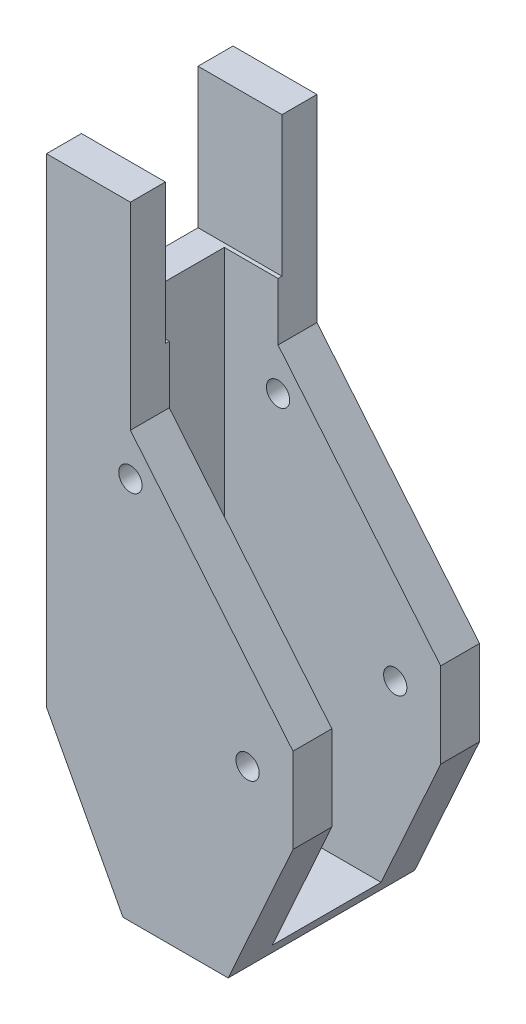
from build123d import *

# Parameters (mm, degrees)
SKETCH_1_W          = 41.838517058
SKETCH_1_H          = 61.659283987
SKETCH_1_R          = 1.5
EXTRUDE_1_DEPTH     = 24
SHELL_START         = 5
SHELL_2_OUTLINE_R   = 6.5
SHELL_2_DEPTH       = 14
SKETCH_7_W          = 14
SKETCH_7_H          = 61.659283987
CUT_EXTRUDE_2_DEPTH = 38
SKETCH_11_W         = 14
SKETCH_11_H         = 61.659283987
EXTRUDE_2_DEPTH     = 14
SKETCH_12_W         = 10.1213772
SKETCH_12_H         = 61.659283987
CUT_EXTRUDE_3_DEPTH = 52.896145639
CUT_EXTRUDE_5_DEPTH = 47.819908548
SKETCH_18_W         = 15
SKETCH_18_H         = 18
CUT_EXTRUDE_6_DEPTH = 54.011520411
EXTRUDE_5_DEPTH     = 24
SKETCH_22_W         = 27.838517058
SKETCH_22_H         = 14
CUT_EXTRUDE_8_DEPTH = 17
SKETCH_23_W         = 14.991158549
SKETCH_23_H         = 11.73336261
EXTRUDE_8_DEPTH     = 2
FILLET_3_R          = 4


# Read off the part's stored shape, not the designer's step: 抽壳2
with BuildPart() as part:
    # 草图1 → 凸台-拉伸1 (new body)
    with BuildSketch(Plane.XY):
        with Locations((-8.896267572, -4.216675009)):
            Rectangle(SKETCH_1_W, SKETCH_1_H)
        with Locations((-8.896267572, -4.21667501)):
            Circle(SKETCH_1_R, mode=Mode.SUBTRACT)
        with Locations((6.176232993, -28.71667501)):
            Circle(SKETCH_1_R, mode=Mode.SUBTRACT)
    extrude(amount=EXTRUDE_1_DEPTH)

    # 抽壳2 outline → 抽壳2 (cut)
    # profile 1 of 2: a face of its own
    with BuildSketch(Plane.XY.offset(SHELL_START)):
        with BuildLine():
            Line((-24.815526101, 26.612966984), (-24.815526101, -35.046317003))
            Line((-24.815526101, -35.046317003), (4.697844602, -35.046317003))
            ThreePointArc((4.697844602, -35.046317003), (1.097738874, -24.659718332), (12.022990957, -25.876706469))
            Line((12.022990957, -25.876706469), (12.022990957, 26.612966984))
            Line((12.022990957, 26.612966984), (-24.815526101, 26.612966984))
        make_face()
        with Locations((-8.896267572, -4.21667501)):
            Circle(SHELL_2_OUTLINE_R, mode=Mode.SUBTRACT)
    # profile 2 of 2: a face of its own
    with BuildSketch(Plane.XY.offset(SHELL_START)):
        with BuildLine():
            ThreePointArc((12.022990957, -31.556643551), (10.23318967, -33.795169129), (7.654621384, -35.046317003))
            Line((7.654621384, -35.046317003), (12.022990957, -35.046317003))
            Line((12.022990957, -35.046317003), (12.022990957, -31.556643551))
        make_face()
    extrude(amount=SHELL_2_DEPTH, mode=Mode.SUBTRACT)

    # 草图7 → 切除-拉伸2 (cut)
    with BuildSketch(Plane(origin=(12.022990957, 0, 0), x_dir=(0, 0, -1), z_dir=(1, 0, 0))):
        with Locations((-12, -4.216675009)):
            Rectangle(SKETCH_7_W, SKETCH_7_H)
    extrude(amount=-CUT_EXTRUDE_2_DEPTH, mode=Mode.SUBTRACT)

    # 草图11 → 凸台-拉伸2 (add)
    with BuildSketch(Plane.ZY.offset(29.815526101)):
        with Locations((12, -4.216675009)):
            Rectangle(SKETCH_11_W, SKETCH_11_H)
    extrude(amount=-EXTRUDE_2_DEPTH)

    # 草图12 → 切除-拉伸3 (cut, through all)
    with BuildSketch(Plane.XY.offset(24)):
        with Locations((-24.754837501, -4.216675009)):
            Rectangle(SKETCH_12_W, SKETCH_12_H)
    extrude(amount=-CUT_EXTRUDE_3_DEPTH, mode=Mode.SUBTRACT)

    # 草图17 → 切除-拉伸5 (cut, through all)
    with BuildSketch(Plane.XY.offset(24)):
        Polygon((-8.896267572, 26.612966984), (-8.896267572, 1.197379191), (12.022990957, -24.097240197), (12.022990957, 26.612966984), align=None)
    extrude(amount=-CUT_EXTRUDE_5_DEPTH, mode=Mode.SUBTRACT)

    # 草图18 → 切除-拉伸6 (cut, through all)
    with BuildSketch(Plane.ZY.offset(19.694148901)):
        with Locations((12, 17.612966984)):
            Rectangle(SKETCH_18_W, SKETCH_18_H)
    extrude(amount=-CUT_EXTRUDE_6_DEPTH, mode=Mode.SUBTRACT)

    # 草图20 → 凸台-拉伸5 (add)
    with BuildSketch(Plane.XY.offset(24)):
        Polygon((-19.694148901, -35.046317003), (-9.853501275, -53.541034872), (3.683563025, -53.541034872), (12.022990957, -35.046317003), align=None)
    extrude(amount=-EXTRUDE_5_DEPTH)

    # 草图22 → 切除-拉伸8 (cut)
    with BuildSketch(Plane(origin=(0, -35.046317003, 0), x_dir=(1, 0, 0), z_dir=(0, 1, 0))):
        with Locations((-1.896267572, -12)):
            Rectangle(SKETCH_22_W, SKETCH_22_H)
    extrude(amount=-CUT_EXTRUDE_8_DEPTH, mode=Mode.SUBTRACT)

    # 草图23 → 凸台-拉伸8 (add)
    with BuildSketch(Plane(origin=(-29.881783728, -15.899464172, 0), x_dir=(0, 0, -1), z_dir=(0.8828123820911005, 0.469725768961675, 0))):
        with Locations((-11.904751729, -35.446570554)):
            Rectangle(SKETCH_23_W, SKETCH_23_H)
    extrude(amount=EXTRUDE_8_DEPTH)

    # 圆角3
    # the kernel refuses this fillet: 4 mm, written as the material it takes off along each edge
    with BuildSketch(Plane(origin=(-14.221722741, -41.073505124, 19), x_dir=(-0.8828123820904301, -0.4697257689629349, 0), z_dir=(0, 0, -1))) as fillet_3_piece_1:
        with BuildLine():
            CenterArc((4, -3.344189139), FILLET_3_R, 123.274953356, 56.725046644)
            Line((0, -3.344189139), (-0.08, -3.344189139))
            Line((-0.08, -3.344189139), (-0.08, 0))
            Line((-0.08, 0), (0, 0.08))
            ThreePointArc((0, 0.08), (0.902685209, 0.08), (1.761477827, 0.066883783))
            Line((1.761477827, 0.066883783), (1.805370419, 0))
        make_face()
    extrude(amount=14, mode=Mode.SUBTRACT)


solid = part.part
